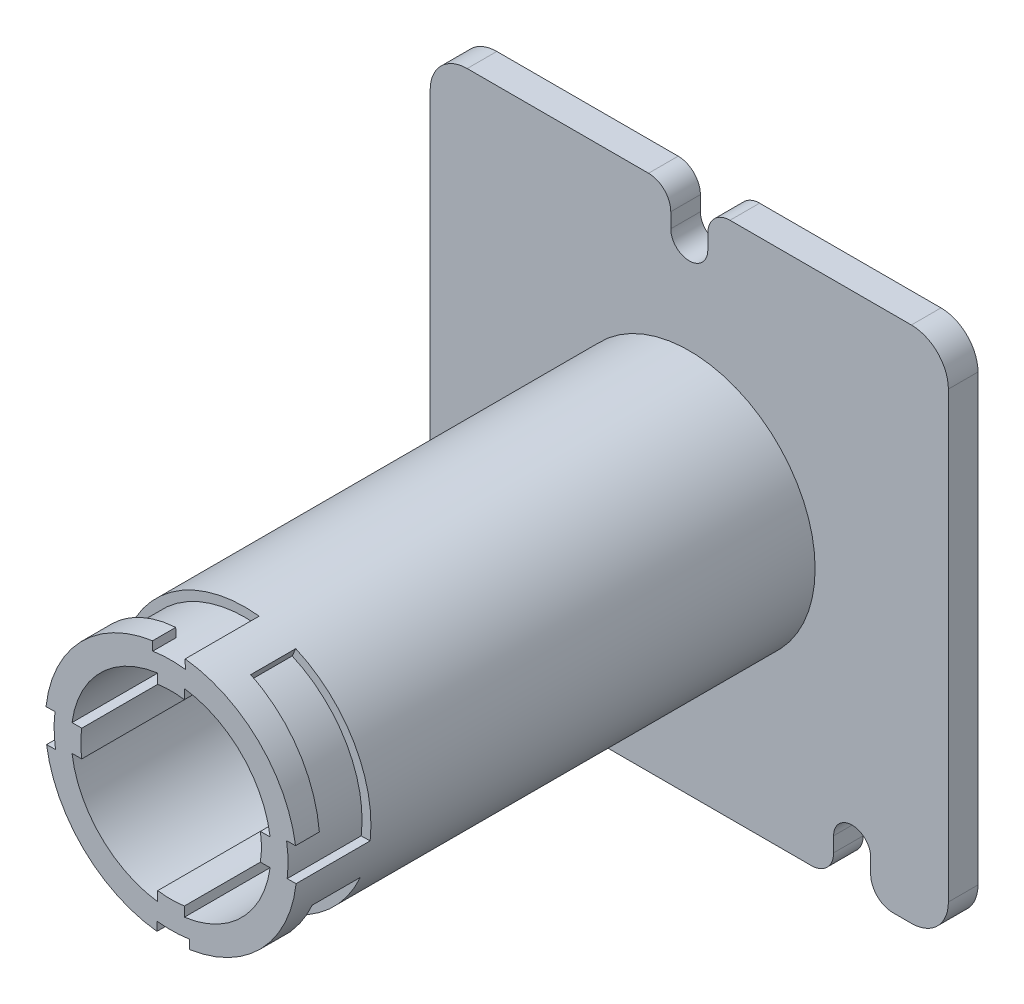
from build123d import *
from build123d.topology import SkipClean

# Parameters (mm, degrees)
SKETCH1_R           = 17
SKETCH1_R_2         = 13.5
BOSS_EXTRUDE1_DEPTH = 70
BOSS_EXTRUDE2_START = 4
SKETCH2_W           = 70
SKETCH2_H           = 70
SKETCH2_R           = 13.5
BOSS_EXTRUDE2_DEPTH = 4
BOSS_EXTRUDE3_START = -89
BOSS_EXTRUDE3_DEPTH = 89
BOSS_EXTRUDE4_START = 15
SKETCH4_R           = 17
SKETCH4_R_2         = 13.5
BOSS_EXTRUDE4_DEPTH = 15
FILLET1_R           = 5
CUT_EXTRUDE1_DEPTH  = 4
FILLET2_R           = 3
FILLET3_R           = 3
FILLET4_R           = 3
FILLET5_R           = 3
FILLET6_R           = 3
FILLET7_R           = 3
BOSS_EXTRUDE5_START = -89
BOSS_EXTRUDE5_DEPTH = 89
CUT_EXTRUDE2_START  = -10
CUT_EXTRUDE2_DEPTH  = 10
CUT_EXTRUDE3_DEPTH  = 10
CUT_EXTRUDE4_DEPTH  = 6
CUT_EXTRUDE6_START  = 6
CUT_EXTRUDE6_DEPTH  = 6
CHAMFER1_SIZE       = 10
CHAMFER1_SIZE_2     = 0.874886635
CUT_EXTRUDE7_DEPTH  = 0.5
CHAMFER2_SIZE       = 10
CHAMFER2_SIZE_2     = 0.874886635
CUT_EXTRUDE8_START  = -0.5
CUT_EXTRUDE8_DEPTH  = 0.5
CHAMFER3_SIZE       = 10
CHAMFER3_SIZE_2     = 0.874886635
CHAMFER4_SIZE       = 10
CHAMFER4_SIZE_2     = 0.874886635
CHAMFER5_SIZE       = 0.546213197
CHAMFER5_SIZE_2     = 1.2
CHAMFER6_SIZE       = 0.546213197
CHAMFER6_SIZE_2     = 1.2
CHAMFER7_SIZE       = 0.786116689
CHAMFER7_SIZE_2     = 15
CHAMFER8_SIZE       = 15
CHAMFER8_SIZE_2     = 0.786116689
CHAMFER9_SIZE       = 15
CHAMFER9_SIZE_2     = 0.786116689
CHAMFER10_SIZE      = 0.786116689
CHAMFER10_SIZE_2    = 15
CHAMFER11_SIZE      = 1.2
CHAMFER11_SIZE_2    = 0.546213197
CHAMFER12_SIZE      = 1.2
CHAMFER12_SIZE_2    = 0.546213197


with BuildPart() as part:
    # Sketch1 → Boss-Extrude1 (new body)
    with BuildSketch(Plane.XY):
        Circle(SKETCH1_R)
        Circle(SKETCH1_R_2, mode=Mode.SUBTRACT)
    extrude(amount=BOSS_EXTRUDE1_DEPTH)

    # Sketch2 → Boss-Extrude2 (add)
    with SkipClean():  # the faces are left unmerged after this step: merging them gives an invalid solid
        with BuildSketch(Plane(origin=(0, 0, 0), x_dir=(-1, 0, 0), z_dir=(0, 0, -1)).offset(BOSS_EXTRUDE2_START)):
            Rectangle(SKETCH2_W, SKETCH2_H)
            Circle(SKETCH2_R, mode=Mode.SUBTRACT)
        extrude(amount=-BOSS_EXTRUDE2_DEPTH)

    # Sketch3 → Boss-Extrude3 (add)
    with BuildSketch(Plane.XY.offset(70).offset(BOSS_EXTRUDE3_START)):
        with BuildLine():
            Line((-12.571793826, 1.8), (-13.379461873, 1.8))
            ThreePointArc((-13.379461873, 1.8), (-13.5, 0), (-13.379461873, -1.8))
            Line((-13.379461873, -1.8), (-12.571793826, -1.8))
            ThreePointArc((-12.571793826, -1.8), (-12.7, 0), (-12.571793826, 1.8))
        make_face()
        with BuildLine():
            Line((-1.8, -12.571793826), (-1.8, -13.379461873))
            ThreePointArc((-1.8, -13.379461873), (0, -13.5), (1.8, -13.379461873))
            Line((1.8, -13.379461873), (1.8, -12.571793826))
            ThreePointArc((1.8, -12.571793826), (0, -12.7), (-1.8, -12.571793826))
        make_face()
        with BuildLine():
            ThreePointArc((13.5, 0), (13.46983176, 0.902015721), (13.379461873, 1.8))
            Line((13.379461873, 1.8), (12.571793826, 1.8))
            ThreePointArc((12.571793826, 1.8), (12.7, 0), (12.571793826, -1.8))
            Line((12.571793826, -1.8), (13.379461873, -1.8))
            ThreePointArc((13.379461873, -1.8), (13.46983176, -0.902015721), (13.5, 0))
        make_face()
        with BuildLine():
            ThreePointArc((1.8, 13.379461873), (0, 13.5), (-1.8, 13.379461873))
            Line((-1.8, 13.379461873), (-1.8, 12.571793826))
            ThreePointArc((-1.8, 12.571793826), (0, 12.7), (1.8, 12.571793826))
            Line((1.8, 12.571793826), (1.8, 13.379461873))
        make_face()
    extrude(amount=BOSS_EXTRUDE3_DEPTH)

    # Sketch4 → Boss-Extrude4 (add)
    with BuildSketch(Plane(origin=(0, 0, -4), x_dir=(-1, 0, 0), z_dir=(0, 0, -1)).offset(BOSS_EXTRUDE4_START)):
        with Locations(Location((0, 0, 0), (0, 0, 180))):
            Circle(SKETCH4_R)
        Circle(SKETCH4_R_2, mode=Mode.SUBTRACT)
    extrude(amount=-BOSS_EXTRUDE4_DEPTH)

    # Fillet1
    fillet1_edges = [part.edges().sort_by_distance(p)[0] for p in [
        (35, 35, -2),
        (35, -35, -2),
        (-35, -35, -2),
        (-35, 35, -2),
    ]]
    fillet(fillet1_edges, radius=FILLET1_R)

    # Sketch6 → Cut-Extrude1 (cut)
    with BuildSketch(Plane(origin=(0, 0, -4), x_dir=(-1, 0, 0), z_dir=(0, 0, -1))):
        with BuildLine():
            Line((-2.5, 30), (-2.5, 35))
            Line((-2.5, 35), (2.5, 35))
            Line((2.5, 35), (2.5, 30))
            ThreePointArc((2.5, 30), (0, 27.5), (-2.5, 30))
        make_face()
        with BuildLine():
            Line((19.5, -30), (19.5, -35))
            Line((19.5, -35), (24.5, -35))
            Line((24.5, -35), (24.5, -30))
            ThreePointArc((24.5, -30), (22, -27.5), (19.5, -30))
        make_face()
        with BuildLine():
            Line((-24.5, -30), (-24.5, -35))
            Line((-24.5, -35), (-19.5, -35))
            Line((-19.5, -35), (-19.5, -30))
            ThreePointArc((-19.5, -30), (-22, -27.5), (-24.5, -30))
        make_face()
    extrude(amount=-CUT_EXTRUDE1_DEPTH, mode=Mode.SUBTRACT)

    # Fillet2
    fillet2_edges = [part.edges().sort_by_distance(p)[0] for p in [
        (-2.5, 35, -2),
    ]]
    fillet(fillet2_edges, radius=FILLET2_R)

    # Fillet3
    fillet3_edges = [part.edges().sort_by_distance(p)[0] for p in [
        (2.5, 35, -2),
    ]]
    fillet(fillet3_edges, radius=FILLET3_R)

    # Fillet4
    fillet4_edges = [part.edges().sort_by_distance(p)[0] for p in [
        (19.5, -35, -2),
    ]]
    fillet(fillet4_edges, radius=FILLET4_R)

    # Fillet5
    fillet5_edges = [part.edges().sort_by_distance(p)[0] for p in [
        (-24.5, -35, -2),
    ]]
    fillet(fillet5_edges, radius=FILLET5_R)

    # Fillet6
    fillet6_edges = [part.edges().sort_by_distance(p)[0] for p in [
        (-19.5, -35, -2),
    ]]
    fillet(fillet6_edges, radius=FILLET6_R)

    # Fillet7
    fillet7_edges = [part.edges().sort_by_distance(p)[0] for p in [
        (24.5, -35, -2),
    ]]
    fillet(fillet7_edges, radius=FILLET7_R)

    # Sketch7 → Boss-Extrude5 (add)
    with BuildSketch(Plane.XY.offset(70).offset(BOSS_EXTRUDE5_START)):
        with BuildLine():
            Line((-1.8, 12.571793826), (-1.8, 12.066482503))
            ThreePointArc((-1.8, 12.066482503), (0, 12.2), (1.8, 12.066482503))
            Line((1.8, 12.066482503), (1.8, 12.571793826))
            ThreePointArc((1.8, 12.571793826), (0, 12.7), (-1.8, 12.571793826))
        make_face()
        with BuildLine():
            Line((12.571793826, 1.8), (12.066482503, 1.8))
            ThreePointArc((12.066482503, 1.8), (12.2, 0), (12.066482503, -1.8))
            Line((12.066482503, -1.8), (12.571793826, -1.8))
            ThreePointArc((12.571793826, -1.8), (12.7, 0), (12.571793826, 1.8))
        make_face()
        with BuildLine():
            Line((1.8, -12.571793826), (1.8, -12.066482503))
            ThreePointArc((1.8, -12.066482503), (0, -12.2), (-1.8, -12.066482503))
            Line((-1.8, -12.066482503), (-1.8, -12.571793826))
            ThreePointArc((-1.8, -12.571793826), (0, -12.7), (1.8, -12.571793826))
        make_face()
        with BuildLine():
            Line((-12.571793826, -1.8), (-12.066482503, -1.8))
            ThreePointArc((-12.066482503, -1.8), (-12.2, 0), (-12.066482503, 1.8))
            Line((-12.066482503, 1.8), (-12.571793826, 1.8))
            ThreePointArc((-12.571793826, 1.8), (-12.7, 0), (-12.571793826, -1.8))
        make_face()
    extrude(amount=BOSS_EXTRUDE5_DEPTH)

    # Sketch8 → Cut-Extrude2 (cut)
    with BuildSketch(Plane.XY.offset(70).offset(CUT_EXTRUDE2_START)):
        with BuildLine():
            Line((-2.493860948, 16.816083301), (-2.472726777, 15.605307504))
            ThreePointArc((-2.472726777, 15.605307504), (-0.275748022, 15.797593583), (1.926603081, 15.682098092))
            Line((1.926603081, 15.682098092), (1.905468911, 16.892873889))
            ThreePointArc((1.905468911, 16.892873889), (-0.296690909, 16.997410818), (-2.493860948, 16.816083301))
        make_face()
        with BuildLine():
            Line((-16.816083301, -2.493860948), (-15.605307504, -2.472726777))
            ThreePointArc((-15.605307504, -2.472726777), (-15.797593583, -0.275748022), (-15.682098092, 1.926603081))
            Line((-15.682098092, 1.926603081), (-16.892873889, 1.905468911))
            ThreePointArc((-16.892873889, 1.905468911), (-16.997410818, -0.296690909), (-16.816083301, -2.493860948))
        make_face()
        with BuildLine():
            Line((15.682098092, -1.926603081), (16.892873889, -1.905468911))
            ThreePointArc((16.892873889, -1.905468911), (16.997410818, 0.296690909), (16.816083301, 2.493860948))
            Line((16.816083301, 2.493860948), (15.605307504, 2.472726777))
            ThreePointArc((15.605307504, 2.472726777), (15.797593583, 0.275748022), (15.682098092, -1.926603081))
        make_face()
        with BuildLine():
            Line((-1.926603081, -15.682098092), (-1.905468911, -16.892873889))
            ThreePointArc((-1.905468911, -16.892873889), (0.296690909, -16.997410818), (2.493860948, -16.816083301))
            Line((2.493860948, -16.816083301), (2.472726777, -15.605307504))
            ThreePointArc((2.472726777, -15.605307504), (0.275748022, -15.797593583), (-1.926603081, -15.682098092))
        make_face()
    extrude(amount=CUT_EXTRUDE2_DEPTH, mode=Mode.SUBTRACT)

    # Sketch9 → Cut-Extrude3 (cut)
    with BuildSketch(Plane(origin=(0, 0, -19), x_dir=(-1, 0, 0), z_dir=(0, 0, -1))):
        with BuildLine():
            Line((-2.493860948, 16.816083301), (-2.472726777, 15.605307504))
            ThreePointArc((-2.472726777, 15.605307504), (-0.275748022, 15.797593583), (1.926603081, 15.682098092))
            Line((1.926603081, 15.682098092), (1.905468911, 16.892873889))
            ThreePointArc((1.905468911, 16.892873889), (-0.296690909, 16.997410818), (-2.493860948, 16.816083301))
        make_face()
        with BuildLine():
            Line((-16.816083301, -2.493860948), (-15.605307504, -2.472726777))
            ThreePointArc((-15.605307504, -2.472726777), (-15.797593583, -0.275748022), (-15.682098092, 1.926603081))
            Line((-15.682098092, 1.926603081), (-16.892873889, 1.905468911))
            ThreePointArc((-16.892873889, 1.905468911), (-16.997410818, -0.296690909), (-16.816083301, -2.493860948))
        make_face()
        with BuildLine():
            Line((15.682098092, -1.926603081), (16.892873889, -1.905468911))
            ThreePointArc((16.892873889, -1.905468911), (16.997410818, 0.296690909), (16.816083301, 2.493860948))
            Line((16.816083301, 2.493860948), (15.605307504, 2.472726777))
            ThreePointArc((15.605307504, 2.472726777), (15.797593583, 0.275748022), (15.682098092, -1.926603081))
        make_face()
        with BuildLine():
            Line((-1.926603081, -15.682098092), (-1.905468911, -16.892873889))
            ThreePointArc((-1.905468911, -16.892873889), (0.296690909, -16.997410818), (2.493860948, -16.816083301))
            Line((2.493860948, -16.816083301), (2.472726777, -15.605307504))
            ThreePointArc((2.472726777, -15.605307504), (0.275748022, -15.797593583), (-1.926603081, -15.682098092))
        make_face()
    extrude(amount=-CUT_EXTRUDE3_DEPTH, mode=Mode.SUBTRACT)

    # Sketch10 → Cut-Extrude4 (cut)
    with BuildSketch(Plane.XY.offset(60)):
        with BuildLine():
            Line((-6.361913705, -14.462574253), (-6.845097024, -15.560997614))
            ThreePointArc((-6.845097024, -15.560997614), (-13.514820707, -10.312595272), (-16.816083301, -2.493860948))
            Line((-16.816083301, -2.493860948), (-15.605307504, -2.472726777))
            ThreePointArc((-15.605307504, -2.472726777), (-12.513145589, -9.646822662), (-6.361913705, -14.462574253))
        make_face()
        with BuildLine():
            Line((2.472726777, -15.605307504), (2.493860948, -16.816083301))
            ThreePointArc((2.493860948, -16.816083301), (10.312595272, -13.514820707), (15.560997614, -6.845097024))
            Line((15.560997614, -6.845097024), (14.462574253, -6.361913705))
            ThreePointArc((14.462574253, -6.361913705), (9.646822662, -12.513145589), (2.472726777, -15.605307504))
        make_face()
        with BuildLine():
            Line((6.361913705, 14.462574253), (6.845097024, 15.560997614))
            ThreePointArc((6.845097024, 15.560997614), (13.514820707, 10.312595272), (16.816083301, 2.493860948))
            Line((16.816083301, 2.493860948), (15.605307504, 2.472726777))
            ThreePointArc((15.605307504, 2.472726777), (12.513145589, 9.646822662), (6.361913705, 14.462574253))
        make_face()
        with BuildLine():
            Line((-2.472726777, 15.605307504), (-2.493860948, 16.816083301))
            ThreePointArc((-2.493860948, 16.816083301), (-10.312595272, 13.514820707), (-15.560997614, 6.845097024))
            Line((-15.560997614, 6.845097024), (-14.462574253, 6.361913705))
            ThreePointArc((-14.462574253, 6.361913705), (-9.646822662, 12.513145589), (-2.472726777, 15.605307504))
        make_face()
    extrude(amount=CUT_EXTRUDE4_DEPTH, mode=Mode.SUBTRACT)

    # Sketch11 → Cut-Extrude6 (cut)
    with BuildSketch(Plane(origin=(0, 0, -9), x_dir=(-1, 0, 0), z_dir=(0, 0, -1)).offset(CUT_EXTRUDE6_START)):
        with BuildLine():
            Line((-6.361913705, -14.462574253), (-6.845097024, -15.560997614))
            ThreePointArc((-6.845097024, -15.560997614), (-13.514820707, -10.312595272), (-16.816083301, -2.493860948))
            Line((-16.816083301, -2.493860948), (-15.605307504, -2.472726777))
            ThreePointArc((-15.605307504, -2.472726777), (-12.513145589, -9.646822662), (-6.361913705, -14.462574253))
        make_face()
        with BuildLine():
            Line((2.472726777, -15.605307504), (2.493860948, -16.816083301))
            ThreePointArc((2.493860948, -16.816083301), (10.312595272, -13.514820707), (15.560997614, -6.845097024))
            Line((15.560997614, -6.845097024), (14.462574253, -6.361913705))
            ThreePointArc((14.462574253, -6.361913705), (9.646822662, -12.513145589), (2.472726777, -15.605307504))
        make_face()
        with BuildLine():
            Line((6.361913705, 14.462574253), (6.845097024, 15.560997614))
            ThreePointArc((6.845097024, 15.560997614), (13.514820707, 10.312595272), (16.816083301, 2.493860948))
            Line((16.816083301, 2.493860948), (15.605307504, 2.472726777))
            ThreePointArc((15.605307504, 2.472726777), (12.513145589, 9.646822662), (6.361913705, 14.462574253))
        make_face()
        with BuildLine():
            Line((-2.472726777, 15.605307504), (-2.493860948, 16.816083301))
            ThreePointArc((-2.493860948, 16.816083301), (-10.312595272, 13.514820707), (-15.560997614, 6.845097024))
            Line((-15.560997614, 6.845097024), (-14.462574253, 6.361913705))
            ThreePointArc((-14.462574253, 6.361913705), (-9.646822662, 12.513145589), (-2.472726777, 15.605307504))
        make_face()
    extrude(amount=-CUT_EXTRUDE6_DEPTH, mode=Mode.SUBTRACT)

    # Chamfer1
    # the kernel refuses this chamfer: 10, 0.874886635 mm, written as the material it takes off along each edge
    with BuildSketch(Plane(origin=(-2.019028072, -10.387073926, 66), x_dir=(-0.9998420759802255, -0.017452308354218342, -0.0033526157940335956), z_dir=(-0.017452406437303152, 0.9998476951563909, 0))) as chamfer1_piece_1_section:
        Polygon((CHAMFER1_SIZE * 0.999994379968, CHAMFER1_SIZE * 0.00335261579403), (-CHAMFER1_SIZE_2 * 0.00335261579503, CHAMFER1_SIZE_2 * 0.999994380264), (0, 0), align=None)
    chamfer1_piece_1 = extrude(amount=53.203641829, mode=Mode.PRIVATE)
    chamfer1_piece_1 = chamfer1_piece_1 - Plane(origin=(0, 0, 66.284272038), x_dir=(-0.15650169477203293, 0.9876776901061811, 0), z_dir=(0, 0, -1)) * Cylinder(15.8, 147, mode=Mode.PRIVATE)
    chamfer1_piece_1 = split(chamfer1_piece_1, bisect_by=Plane(origin=(-5.964938043, 1.8, 66.284272038), z_dir=(0, 1, 0)), keep=Keep.TOP, mode=Mode.PRIVATE)
    add(chamfer1_piece_1, mode=Mode.SUBTRACT)

    # Sketch12 → Cut-Extrude7 (cut)
    with BuildSketch(Plane(origin=(0, 0, 66), x_dir=(-1, 0, 0), z_dir=(0, 0, -1))):
        with BuildLine():
            Line((12.746770499, 11.248103923), (11.810345957, 10.495509915))
            ThreePointArc((11.810345957, 10.495509915), (13.298053936, 8.532394828), (14.462574253, 6.361913705))
            Line((14.462574253, 6.361913705), (15.560997614, 6.845097024))
            ThreePointArc((15.560997614, 6.845097024), (14.324072442, 9.155378129), (12.746770499, 11.248103923))
        make_face()
        with BuildLine():
            Line((-12.896552856, -11.076051843), (-11.960660195, -10.323885301))
            ThreePointArc((-11.960660195, -10.323885301), (-13.359308904, -8.436164152), (-14.462574253, -6.361913705))
            Line((-14.462574253, -6.361913705), (-15.560997614, -6.845097024))
            ThreePointArc((-15.560997614, -6.845097024), (-14.385176028, -9.059067868), (-12.896552856, -11.076051843))
        make_face()
    extrude(amount=-CUT_EXTRUDE7_DEPTH, mode=Mode.SUBTRACT)

    # Chamfer2
    # the kernel refuses this chamfer: 10, 0.874886635 mm, written as the material it takes off along each edge
    with BuildSketch(Plane(origin=(2.019028072, 10.387073926, 66), x_dir=(0.9998420759802257, 0.017452308354206976, -0.0033526157940335956), z_dir=(0.017452406437291786, -0.9998476951563912, 0))) as chamfer2_piece_1_section:
        Polygon((CHAMFER2_SIZE * 0.999994379968, CHAMFER2_SIZE * 0.00335261579403), (-CHAMFER2_SIZE_2 * 0.00335261579503, CHAMFER2_SIZE_2 * 0.999994380264), (0, 0), align=None)
    chamfer2_piece_1 = extrude(amount=53.203641829, mode=Mode.PRIVATE)
    chamfer2_piece_1 = chamfer2_piece_1 - Plane(origin=(0, 0, 66.284376277), x_dir=(0.7570038097914864, -0.6534104620842668, 0), z_dir=(0, 0, -1)) * Cylinder(15.8, 147, mode=Mode.PRIVATE)
    chamfer2_piece_1 = split(chamfer2_piece_1, bisect_by=Plane(origin=(5.962586071, 1.8, 66.284376277), z_dir=(0, -1, 0)), keep=Keep.TOP, mode=Mode.PRIVATE)
    add(chamfer2_piece_1, mode=Mode.SUBTRACT)

    # Sketch13 → Cut-Extrude8 (cut)
    with BuildSketch(Plane.XY.offset(-15).offset(CUT_EXTRUDE8_START)):
        with BuildLine():
            Line((12.746770499, 11.248103923), (11.810345957, 10.495509915))
            ThreePointArc((11.810345957, 10.495509915), (13.298053936, 8.532394828), (14.462574253, 6.361913705))
            Line((14.462574253, 6.361913705), (15.560997614, 6.845097024))
            ThreePointArc((15.560997614, 6.845097024), (14.324072442, 9.155378129), (12.746770499, 11.248103923))
        make_face()
        with BuildLine():
            Line((-12.896552856, -11.076051843), (-11.960660195, -10.323885301))
            ThreePointArc((-11.960660195, -10.323885301), (-13.359308904, -8.436164152), (-14.462574253, -6.361913705))
            Line((-14.462574253, -6.361913705), (-15.560997614, -6.845097024))
            ThreePointArc((-15.560997614, -6.845097024), (-14.385176028, -9.059067868), (-12.896552856, -11.076051843))
        make_face()
    extrude(amount=CUT_EXTRUDE8_DEPTH, mode=Mode.SUBTRACT)

    # Chamfer3
    # the kernel refuses this chamfer: 10, 0.874886635 mm, written as the material it takes off along each edge
    with BuildSketch(Plane(origin=(-2.019028072, 10.387073926, -15), x_dir=(-0.9998420759802257, 0.017452308354206976, 0.0033526157940332534), z_dir=(-0.017452406437291786, -0.9998476951563912, 0))) as chamfer3_piece_1_section:
        Polygon((CHAMFER3_SIZE * 0.999994379968, CHAMFER3_SIZE * 0.00335261579403), (-CHAMFER3_SIZE_2 * 0.00335261579503, CHAMFER3_SIZE_2 * 0.999994380264), (0, 0), align=None)
    chamfer3_piece_1 = extrude(amount=53.203641829, mode=Mode.PRIVATE)
    chamfer3_piece_1 = chamfer3_piece_1 - Plane(origin=(0, 0, -15.284376279), x_dir=(-0.15650169477202155, -0.9876776901061829, 0), z_dir=(0, 0, -1)) * Cylinder(15.8, 147, mode=Mode.PRIVATE)
    chamfer3_piece_1 = split(chamfer3_piece_1, bisect_by=Plane(origin=(-5.962586114, 1.8, -15.284376279), z_dir=(0, -1, 0)), keep=Keep.TOP, mode=Mode.PRIVATE)
    add(chamfer3_piece_1, mode=Mode.SUBTRACT)

    # Chamfer4
    # the kernel refuses this chamfer: 10, 0.874886635 mm, written as the material it takes off along each edge
    with BuildSketch(Plane(origin=(2.019028072, -10.387073926, -15), x_dir=(0.9998420759802255, -0.017452308354218342, 0.003352615794033254), z_dir=(0.017452406437303152, 0.9998476951563909, 0))) as chamfer4_piece_1_section:
        Polygon((CHAMFER4_SIZE * 0.999994379968, CHAMFER4_SIZE * 0.00335261579403), (-CHAMFER4_SIZE_2 * 0.00335261579503, CHAMFER4_SIZE_2 * 0.999994380264), (0, 0), align=None)
    chamfer4_piece_1 = extrude(amount=53.203641829, mode=Mode.PRIVATE)
    chamfer4_piece_1 = chamfer4_piece_1 - Plane(origin=(0, 0, -15.284530127), x_dir=(0.9876776901061811, -0.156501694772033, 0), z_dir=(0, 0, -1)) * Cylinder(15.8, 147, mode=Mode.PRIVATE)
    chamfer4_piece_1 = split(chamfer4_piece_1, bisect_by=Plane(origin=(5.959113276, -1.8, -15.284530127), z_dir=(0, 1, 0)), keep=Keep.TOP, mode=Mode.PRIVATE)
    add(chamfer4_piece_1, mode=Mode.SUBTRACT)

    # Chamfer5
    # the kernel refuses this chamfer: 1.2, 0.546213197 mm, written as the material it takes off along each edge
    with BuildSketch(Plane(origin=(14.811264454, 12.907314795, -14.791449342), x_dir=(0.10146446413788957, -0.019507396680169042, -0.9946478894523294), z_dir=(-0.7777087701526035, -0.6250359045345559, -0.06707597834094106))) as chamfer5_piece_1_section:
        Polygon((CHAMFER5_SIZE * 0.99689302213, -CHAMFER5_SIZE * 0.0787674010281), (-CHAMFER5_SIZE_2 * 0.0230423384215, -CHAMFER5_SIZE_2 * 0.999734490072), (0, 0), align=None)
    chamfer5_piece_1 = extrude(amount=6.967836704, mode=Mode.PRIVATE)
    chamfer5_piece_1 = split(chamfer5_piece_1, bisect_by=Plane(origin=(13.056233128, 12.023455672, -15.5), z_dir=(0, 0, 1)), keep=Keep.TOP, mode=Mode.PRIVATE)
    chamfer5_piece_1 = chamfer5_piece_1 - Plane(origin=(0, 0, -15.113168239), x_dir=(0.7474902504572172, 0.6642727794147574, 0), z_dir=(0, 0, -1)) * Cylinder(15.8, 19, mode=Mode.PRIVATE)
    add(chamfer5_piece_1, mode=Mode.SUBTRACT)

    # Chamfer6
    # the kernel refuses this chamfer: 1.2, 0.546213197 mm, written as the material it takes off along each edge
    with BuildSketch(Plane(origin=(-14.806087436, -12.610723585, -14.791449342), x_dir=(-0.10146446413789056, 0.01950739668017009, -0.9946478894523294), z_dir=(0.7777087701526, 0.6250359045345606, -0.06707597834094074))) as chamfer6_piece_1_section:
        Polygon((CHAMFER6_SIZE * 0.99689302213, -CHAMFER6_SIZE * 0.0787674010281), (-CHAMFER6_SIZE_2 * 0.0230423384215, -CHAMFER6_SIZE_2 * 0.999734490072), (0, 0), align=None)
    chamfer6_piece_1 = extrude(amount=6.767901636, mode=Mode.PRIVATE)
    chamfer6_piece_1 = chamfer6_piece_1 - Plane(origin=(0, 0, -15.107110264), x_dir=(-0.7570038097914845, -0.653410462084269, 0), z_dir=(0, 0, -1)) * Cylinder(15.8, 19, mode=Mode.PRIVATE)
    chamfer6_piece_1 = split(chamfer6_piece_1, bisect_by=Plane(origin=(-13.129340238, -11.788512935, -15.5), z_dir=(0, 0, 1)), keep=Keep.TOP, mode=Mode.PRIVATE)
    add(chamfer6_piece_1, mode=Mode.SUBTRACT)

    # Chamfer7
    # the kernel refuses this chamfer: 15, 0.786116689 mm, written as the material it takes off along each edge
    with BuildSketch(Plane(origin=(55.80816703, -3.174470301, -15), x_dir=(0.010316960115122167, 0.5910582491413826, -0.8065628967761325), z_dir=(-0.9998476951563913, 0.017452406437284743, 0))) as chamfer7_piece_1_section:
        Polygon((CHAMFER7_SIZE * 0.806562897028, CHAMFER7_SIZE * 0.591148284073), (-CHAMFER7_SIZE_2 * 0.591148283888, CHAMFER7_SIZE_2 * 0.806562896776), (0, 0), align=None)
    chamfer7_piece_1 = extrude(amount=79.207006867, mode=Mode.PRIVATE)
    chamfer7_piece_1 = chamfer7_piece_1 - Plane(origin=(0, 0, -15.594587872), x_dir=(0.9876776901061811, -0.156501694772033, 0), z_dir=(0, 0, -1)) * Cylinder(15.8, 207, mode=Mode.PRIVATE)
    chamfer7_piece_1 = split(chamfer7_piece_1, bisect_by=Plane(origin=(4.14951665, -9.433119569, -15.594587872), z_dir=(0.9153528008024124, 0.40265276611887213, 0)), keep=Keep.TOP, mode=Mode.PRIVATE)
    add(chamfer7_piece_1, mode=Mode.SUBTRACT)

    # Chamfer8
    # the kernel refuses this chamfer: 15, 0.786116689 mm, written as the material it takes off along each edge
    with BuildSketch(Plane(origin=(-55.80816703, 3.174470301, -15), x_dir=(0.017452371076383023, 0.9998456693312789, 0.0020130234223822143), z_dir=(0.9998476951563912, -0.01745240643729189, 0))) as chamfer8_piece_1_section:
        Polygon((CHAMFER8_SIZE * 0.999997973866, -CHAMFER8_SIZE * 0.00201302342238), (-CHAMFER8_SIZE_2 * 0.00201302342301, -CHAMFER8_SIZE_2 * 0.999997974179), (0, 0), align=None)
    chamfer8_piece_1 = extrude(amount=79.207006867, mode=Mode.PRIVATE)
    chamfer8_piece_1 = chamfer8_piece_1 - Plane(origin=(0, 0, -15.231709406), x_dir=(0.9876776901061818, -0.15650169477202877, 0), z_dir=(0, 0, -1)) * Cylinder(15.8, 219, mode=Mode.PRIVATE)
    chamfer8_piece_1 = split(chamfer8_piece_1, bisect_by=Plane(origin=(-6.058371867, 13.772530884, -15.231709406), z_dir=(-0.9153528008024063, -0.40265276611888606, 0)), keep=Keep.TOP, mode=Mode.PRIVATE)
    add(chamfer8_piece_1, mode=Mode.SUBTRACT)

    # Chamfer9
    # the kernel refuses this chamfer: 15, 0.786116689 mm, written as the material it takes off along each edge
    with BuildSketch(Plane(origin=(-55.80816703, -3.174470301, 66), x_dir=(0.01745237107637588, -0.999845669331279, -0.002013023422382328), z_dir=(0.9998476951563913, 0.017452406437284743, 0))) as chamfer9_piece_1_section:
        Polygon((CHAMFER9_SIZE * 0.999997973866, -CHAMFER9_SIZE * 0.00201302342238), (-CHAMFER9_SIZE_2 * 0.00201302342301, -CHAMFER9_SIZE_2 * 0.999997974179), (0, 0), align=None)
    chamfer9_piece_1 = extrude(amount=79.207006867, mode=Mode.PRIVATE)
    chamfer9_piece_1 = split(chamfer9_piece_1, bisect_by=Plane(origin=(-5.240991945, -11.914376505, 66.206350897), z_dir=(-0.9153528008024121, 0.40265276611887274, 0)), keep=Keep.TOP, mode=Mode.PRIVATE)
    chamfer9_piece_1 = chamfer9_piece_1 - Plane(origin=(0, 0, 66.206350897), x_dir=(-0.9876776901061811, -0.15650169477203293, 0), z_dir=(0, 0, -1)) * Cylinder(15.8, 219, mode=Mode.PRIVATE)
    add(chamfer9_piece_1, mode=Mode.SUBTRACT)

    # Chamfer10
    # the kernel refuses this chamfer: 15, 0.786116689 mm, written as the material it takes off along each edge
    with BuildSketch(Plane(origin=(55.80816703, 3.174470301, 66), x_dir=(0.010316960115126407, -0.5910582491413834, 0.8065628967761319), z_dir=(-0.9998476951563912, -0.01745240643729189, 0))) as chamfer10_piece_1_section:
        Polygon((CHAMFER10_SIZE * 0.806562897028, CHAMFER10_SIZE * 0.591148284073), (-CHAMFER10_SIZE_2 * 0.591148283888, CHAMFER10_SIZE_2 * 0.806562896776), (0, 0), align=None)
    chamfer10_piece_1 = extrude(amount=79.207006867, mode=Mode.PRIVATE)
    chamfer10_piece_1 = split(chamfer10_piece_1, bisect_by=Plane(origin=(4.14951665, 9.433119569, 66.594587872), z_dir=(0.9153528008024063, -0.40265276611888606, 0)), keep=Keep.TOP, mode=Mode.PRIVATE)
    chamfer10_piece_1 = chamfer10_piece_1 - Plane(origin=(0, 0, 66.594587872), x_dir=(0.9876776901061813, 0.15650169477203138, 0), z_dir=(0, 0, -1)) * Cylinder(15.8, 207, mode=Mode.PRIVATE)
    add(chamfer10_piece_1, mode=Mode.SUBTRACT)

    # Chamfer11
    # the kernel refuses this chamfer: 1.2, 0.546213197 mm, written as the material it takes off along each edge
    with BuildSketch(Plane(origin=(9.542630978, -8.380542064, 66.245412966), x_dir=(-0.6238939993497704, -0.7805154832751479, 0.03939362820445865), z_dir=(0.7777087701526008, -0.6250359045345595, -0.06707597834094081))) as chamfer11_piece_1_section:
        Polygon((CHAMFER11_SIZE * 0.999866964113, -CHAMFER11_SIZE * 0.0163111641311), (CHAMFER11_SIZE_2 * 0.0394825480352, -CHAMFER11_SIZE_2 * 0.999220260722), (0, 0), align=None)
    chamfer11_piece_1 = extrude(amount=6.767901636, mode=Mode.PRIVATE)
    chamfer11_piece_1 = chamfer11_piece_1 - Plane(origin=(0, 0, 66.107110265), x_dir=(0.7570038097914108, -0.6534104620843546, 0), z_dir=(0, 0, -1)) * Cylinder(15.8, 19, mode=Mode.PRIVATE)
    chamfer11_piece_1 = split(chamfer11_piece_1, bisect_by=Plane(origin=(13.129340239, -11.788512935, 66.5), z_dir=(0, 0, -1)), keep=Keep.TOP, mode=Mode.PRIVATE)
    add(chamfer11_piece_1, mode=Mode.SUBTRACT)

    # Chamfer12
    # the kernel refuses this chamfer: 1.2, 0.546213197 mm, written as the material it takes off along each edge
    with BuildSketch(Plane(origin=(-14.811264454, 12.907314795, 65.791449342), x_dir=(0.6238939993497683, 0.7805154832751501, 0.03939362820444706), z_dir=(0.7777087701526032, -0.6250359045345565, 0.06707597834094103))) as chamfer12_piece_1_section:
        Polygon((CHAMFER12_SIZE * 0.999866964113, CHAMFER12_SIZE * 0.0163111641311), (CHAMFER12_SIZE_2 * 0.0394825480352, CHAMFER12_SIZE_2 * 0.999220260722), (0, 0), align=None)
    chamfer12_piece_1 = extrude(amount=6.967836704, mode=Mode.PRIVATE)
    chamfer12_piece_1 = chamfer12_piece_1 - Plane(origin=(0, 0, 66.113168239), x_dir=(-0.15650169477203293, 0.9876776901061811, 0), z_dir=(0, 0, -1)) * Cylinder(15.8, 19, mode=Mode.PRIVATE)
    chamfer12_piece_1 = split(chamfer12_piece_1, bisect_by=Plane(origin=(-13.056233133, 12.023455678, 66.5), z_dir=(0, 0, -1)), keep=Keep.TOP, mode=Mode.PRIVATE)
    add(chamfer12_piece_1, mode=Mode.SUBTRACT)


solid = part.part
